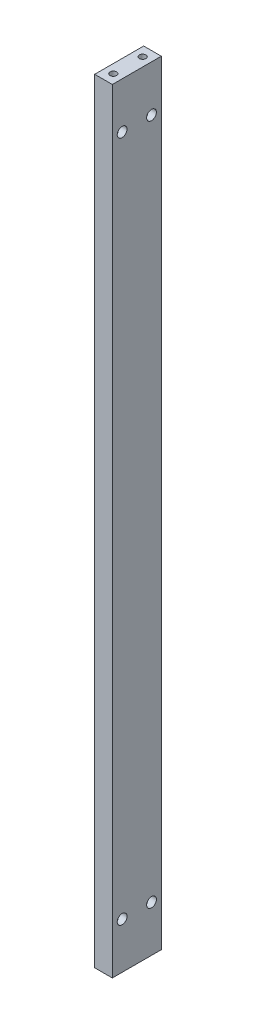
from build123d import *

# Parameters (mm, degrees)
SKETCH1_W                             = 18
SKETCH1_H                             = 50
BASE_DEPTH                            = 789.8
END_BOLT_HOLES_FOR_INSERTS_AT_2_COUNT = 2
END_BOLT_HOLES_FOR_INSERTS_AT_2_PITCH = 30
CROSS_DOWEL_BOLT_CLEARANCE_HOLES_D    = 10


with BuildPart() as part:
    # Sketch1 → base (new body)
    with BuildSketch(Plane(origin=(0, 0, 0), x_dir=(1, 0, 0), z_dir=(0, 1, 0))):
        with Locations((9, 25)):
            Rectangle(SKETCH1_W, SKETCH1_H)
    extrude(amount=BASE_DEPTH)

    # Sketch3 → end bolt holes for inserts (revolve, cut)
    with BuildSketch(Plane(origin=(9, 0, -40), x_dir=(0, 0, -1), z_dir=(1, 0, 0))):
        Polygon((0, 0), (0, 58.982840043), (3.3, 57), (3.3, 0), align=None)
    end_bolt_holes_for_inserts = revolve(axis=Axis((9, -6.35, -40), (0, 1, 0)), mode=Mode.SUBTRACT)

    # end bolt holes for inserts at 2: end bolt holes for inserts ×2
    with Locations(*[(0, 0, i * END_BOLT_HOLES_FOR_INSERTS_AT_2_PITCH) for i in range(1, END_BOLT_HOLES_FOR_INSERTS_AT_2_COUNT)]):
        add(end_bolt_holes_for_inserts, mode=Mode.SUBTRACT)

    # cross dowel bolt clearance holes (through all)
    with Locations(Plane.ZY):
        with Locations((-40, 47), (-10, 47)):
            cross_dowel_bolt_clearance_holes = Hole(CROSS_DOWEL_BOLT_CLEARANCE_HOLES_D / 2)

    # mirror end bolt holes: end bolt holes for inserts, cross dowel bolt clearance holes across plane
    add(end_bolt_holes_for_inserts.mirror(Plane(origin=(0, 394.9, 0), x_dir=(0, 0, 1), z_dir=(0, -1, 0))), mode=Mode.SUBTRACT)
    add(cross_dowel_bolt_clearance_holes.mirror(Plane(origin=(0, 394.9, 0), x_dir=(0, 0, 1), z_dir=(0, -1, 0))), mode=Mode.SUBTRACT)

    # mirror end bolt holes copy 1 sketch → mirror end bolt holes copy 1 (revolve, cut)
    with BuildSketch(Plane(origin=(9, 789.8, -10), x_dir=(0, 0, -1), z_dir=(1, 0, 0))):
        Polygon((0, 0), (0, -58.982840043), (3.3, -57), (3.3, 0), align=None)
    revolve(axis=Axis((9, 796.15, -10), (0, 1, 0)), mode=Mode.SUBTRACT)


solid = part.part
